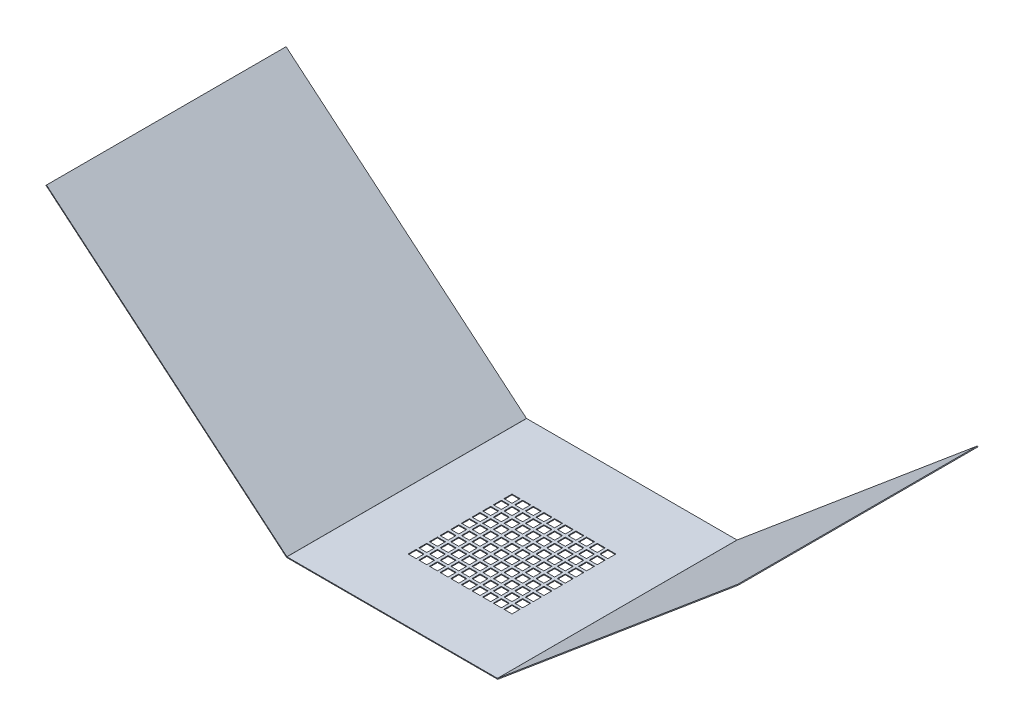
from build123d import *

# Parameters (mm, degrees)
CROQUIS1_W                = 800
CROQUIS1_H                = 900
BRIDA_BASE1_DEPTH         = 2.9
BRIDA_START               = -450
BRIDA_DE_ARISTA1_DEPTH    = 900
BRIDA_DE_ARISTA1_2_DEPTH  = 900
CROQUIS12_W               = 30
CROQUIS12_H               = 30
CORTAR_EXTRUIR1_DEPTH     = 10
MATRIZL1_COUNT            = 10
MATRIZL1_PITCH            = 40
MATRIZL2_COUNT            = 10
MATRIZL2_PITCH            = 40
MATRIZL2_COPY_1_SKETCH_W  = 30
MATRIZL2_COPY_1_SKETCH_H  = 30
MATRIZL2_COPY_1_DEPTH     = 10
MATRIZL2_COPY_2_SKETCH_W  = 30
MATRIZL2_COPY_2_SKETCH_H  = 30
MATRIZL2_COPY_2_DEPTH     = 10
MATRIZL2_COPY_3_SKETCH_W  = 30
MATRIZL2_COPY_3_SKETCH_H  = 30
MATRIZL2_COPY_3_DEPTH     = 10
MATRIZL2_COPY_4_SKETCH_W  = 30
MATRIZL2_COPY_4_SKETCH_H  = 30
MATRIZL2_COPY_4_DEPTH     = 10
MATRIZL2_COPY_5_SKETCH_W  = 30
MATRIZL2_COPY_5_SKETCH_H  = 30
MATRIZL2_COPY_5_DEPTH     = 10
MATRIZL2_COPY_6_SKETCH_W  = 30
MATRIZL2_COPY_6_SKETCH_H  = 30
MATRIZL2_COPY_6_DEPTH     = 10
MATRIZL2_COPY_7_SKETCH_W  = 30
MATRIZL2_COPY_7_SKETCH_H  = 30
MATRIZL2_COPY_7_DEPTH     = 10
MATRIZL2_COPY_8_SKETCH_W  = 30
MATRIZL2_COPY_8_SKETCH_H  = 30
MATRIZL2_COPY_8_DEPTH     = 10
MATRIZL2_COPY_9_SKETCH_W  = 30
MATRIZL2_COPY_9_SKETCH_H  = 30
MATRIZL2_COPY_9_DEPTH     = 10
MATRIZL2_COPY_10_SKETCH_W = 30
MATRIZL2_COPY_10_SKETCH_H = 30
MATRIZL2_COPY_10_DEPTH    = 10
MATRIZL2_COPY_11_SKETCH_W = 30
MATRIZL2_COPY_11_SKETCH_H = 30
MATRIZL2_COPY_11_DEPTH    = 10
MATRIZL2_COPY_12_SKETCH_W = 30
MATRIZL2_COPY_12_SKETCH_H = 30
MATRIZL2_COPY_12_DEPTH    = 10
MATRIZL2_COPY_13_SKETCH_W = 30
MATRIZL2_COPY_13_SKETCH_H = 30
MATRIZL2_COPY_13_DEPTH    = 10
MATRIZL2_COPY_14_SKETCH_W = 30
MATRIZL2_COPY_14_SKETCH_H = 30
MATRIZL2_COPY_14_DEPTH    = 10
MATRIZL2_COPY_15_SKETCH_W = 30
MATRIZL2_COPY_15_SKETCH_H = 30
MATRIZL2_COPY_15_DEPTH    = 10
MATRIZL2_COPY_16_SKETCH_W = 30
MATRIZL2_COPY_16_SKETCH_H = 30
MATRIZL2_COPY_16_DEPTH    = 10
MATRIZL2_COPY_17_SKETCH_W = 30
MATRIZL2_COPY_17_SKETCH_H = 30
MATRIZL2_COPY_17_DEPTH    = 10
MATRIZL2_COPY_18_SKETCH_W = 30
MATRIZL2_COPY_18_SKETCH_H = 30
MATRIZL2_COPY_18_DEPTH    = 10
MATRIZL2_COPY_19_SKETCH_W = 30
MATRIZL2_COPY_19_SKETCH_H = 30
MATRIZL2_COPY_19_DEPTH    = 10
MATRIZL2_COPY_20_SKETCH_W = 30
MATRIZL2_COPY_20_SKETCH_H = 30
MATRIZL2_COPY_20_DEPTH    = 10
MATRIZL2_COPY_21_SKETCH_W = 30
MATRIZL2_COPY_21_SKETCH_H = 30
MATRIZL2_COPY_21_DEPTH    = 10
MATRIZL2_COPY_22_SKETCH_W = 30
MATRIZL2_COPY_22_SKETCH_H = 30
MATRIZL2_COPY_22_DEPTH    = 10
MATRIZL2_COPY_23_SKETCH_W = 30
MATRIZL2_COPY_23_SKETCH_H = 30
MATRIZL2_COPY_23_DEPTH    = 10
MATRIZL2_COPY_24_SKETCH_W = 30
MATRIZL2_COPY_24_SKETCH_H = 30
MATRIZL2_COPY_24_DEPTH    = 10
MATRIZL2_COPY_25_SKETCH_W = 30
MATRIZL2_COPY_25_SKETCH_H = 30
MATRIZL2_COPY_25_DEPTH    = 10
MATRIZL2_COPY_26_SKETCH_W = 30
MATRIZL2_COPY_26_SKETCH_H = 30
MATRIZL2_COPY_26_DEPTH    = 10
MATRIZL2_COPY_27_SKETCH_W = 30
MATRIZL2_COPY_27_SKETCH_H = 30
MATRIZL2_COPY_27_DEPTH    = 10
MATRIZL2_COPY_28_SKETCH_W = 30
MATRIZL2_COPY_28_SKETCH_H = 30
MATRIZL2_COPY_28_DEPTH    = 10
MATRIZL2_COPY_29_SKETCH_W = 30
MATRIZL2_COPY_29_SKETCH_H = 30
MATRIZL2_COPY_29_DEPTH    = 10
MATRIZL2_COPY_30_SKETCH_W = 30
MATRIZL2_COPY_30_SKETCH_H = 30
MATRIZL2_COPY_30_DEPTH    = 10
MATRIZL2_COPY_31_SKETCH_W = 30
MATRIZL2_COPY_31_SKETCH_H = 30
MATRIZL2_COPY_31_DEPTH    = 10
MATRIZL2_COPY_32_SKETCH_W = 30
MATRIZL2_COPY_32_SKETCH_H = 30
MATRIZL2_COPY_32_DEPTH    = 10
MATRIZL2_COPY_33_SKETCH_W = 30
MATRIZL2_COPY_33_SKETCH_H = 30
MATRIZL2_COPY_33_DEPTH    = 10
MATRIZL2_COPY_34_SKETCH_W = 30
MATRIZL2_COPY_34_SKETCH_H = 30
MATRIZL2_COPY_34_DEPTH    = 10
MATRIZL2_COPY_35_SKETCH_W = 30
MATRIZL2_COPY_35_SKETCH_H = 30
MATRIZL2_COPY_35_DEPTH    = 10
MATRIZL2_COPY_36_SKETCH_W = 30
MATRIZL2_COPY_36_SKETCH_H = 30
MATRIZL2_COPY_36_DEPTH    = 10
MATRIZL2_COPY_37_SKETCH_W = 30
MATRIZL2_COPY_37_SKETCH_H = 30
MATRIZL2_COPY_37_DEPTH    = 10
MATRIZL2_COPY_38_SKETCH_W = 30
MATRIZL2_COPY_38_SKETCH_H = 30
MATRIZL2_COPY_38_DEPTH    = 10
MATRIZL2_COPY_39_SKETCH_W = 30
MATRIZL2_COPY_39_SKETCH_H = 30
MATRIZL2_COPY_39_DEPTH    = 10
MATRIZL2_COPY_40_SKETCH_W = 30
MATRIZL2_COPY_40_SKETCH_H = 30
MATRIZL2_COPY_40_DEPTH    = 10
MATRIZL2_COPY_41_SKETCH_W = 30
MATRIZL2_COPY_41_SKETCH_H = 30
MATRIZL2_COPY_41_DEPTH    = 10
MATRIZL2_COPY_42_SKETCH_W = 30
MATRIZL2_COPY_42_SKETCH_H = 30
MATRIZL2_COPY_42_DEPTH    = 10
MATRIZL2_COPY_43_SKETCH_W = 30
MATRIZL2_COPY_43_SKETCH_H = 30
MATRIZL2_COPY_43_DEPTH    = 10
MATRIZL2_COPY_44_SKETCH_W = 30
MATRIZL2_COPY_44_SKETCH_H = 30
MATRIZL2_COPY_44_DEPTH    = 10
MATRIZL2_COPY_45_SKETCH_W = 30
MATRIZL2_COPY_45_SKETCH_H = 30
MATRIZL2_COPY_45_DEPTH    = 10
MATRIZL2_COPY_46_SKETCH_W = 30
MATRIZL2_COPY_46_SKETCH_H = 30
MATRIZL2_COPY_46_DEPTH    = 10
MATRIZL2_COPY_47_SKETCH_W = 30
MATRIZL2_COPY_47_SKETCH_H = 30
MATRIZL2_COPY_47_DEPTH    = 10
MATRIZL2_COPY_48_SKETCH_W = 30
MATRIZL2_COPY_48_SKETCH_H = 30
MATRIZL2_COPY_48_DEPTH    = 10
MATRIZL2_COPY_49_SKETCH_W = 30
MATRIZL2_COPY_49_SKETCH_H = 30
MATRIZL2_COPY_49_DEPTH    = 10
MATRIZL2_COPY_50_SKETCH_W = 30
MATRIZL2_COPY_50_SKETCH_H = 30
MATRIZL2_COPY_50_DEPTH    = 10
MATRIZL2_COPY_51_SKETCH_W = 30
MATRIZL2_COPY_51_SKETCH_H = 30
MATRIZL2_COPY_51_DEPTH    = 10
MATRIZL2_COPY_52_SKETCH_W = 30
MATRIZL2_COPY_52_SKETCH_H = 30
MATRIZL2_COPY_52_DEPTH    = 10
MATRIZL2_COPY_53_SKETCH_W = 30
MATRIZL2_COPY_53_SKETCH_H = 30
MATRIZL2_COPY_53_DEPTH    = 10
MATRIZL2_COPY_54_SKETCH_W = 30
MATRIZL2_COPY_54_SKETCH_H = 30
MATRIZL2_COPY_54_DEPTH    = 10
MATRIZL2_COPY_55_SKETCH_W = 30
MATRIZL2_COPY_55_SKETCH_H = 30
MATRIZL2_COPY_55_DEPTH    = 10
MATRIZL2_COPY_56_SKETCH_W = 30
MATRIZL2_COPY_56_SKETCH_H = 30
MATRIZL2_COPY_56_DEPTH    = 10
MATRIZL2_COPY_57_SKETCH_W = 30
MATRIZL2_COPY_57_SKETCH_H = 30
MATRIZL2_COPY_57_DEPTH    = 10
MATRIZL2_COPY_58_SKETCH_W = 30
MATRIZL2_COPY_58_SKETCH_H = 30
MATRIZL2_COPY_58_DEPTH    = 10
MATRIZL2_COPY_59_SKETCH_W = 30
MATRIZL2_COPY_59_SKETCH_H = 30
MATRIZL2_COPY_59_DEPTH    = 10
MATRIZL2_COPY_60_SKETCH_W = 30
MATRIZL2_COPY_60_SKETCH_H = 30
MATRIZL2_COPY_60_DEPTH    = 10
MATRIZL2_COPY_61_SKETCH_W = 30
MATRIZL2_COPY_61_SKETCH_H = 30
MATRIZL2_COPY_61_DEPTH    = 10
MATRIZL2_COPY_62_SKETCH_W = 30
MATRIZL2_COPY_62_SKETCH_H = 30
MATRIZL2_COPY_62_DEPTH    = 10
MATRIZL2_COPY_63_SKETCH_W = 30
MATRIZL2_COPY_63_SKETCH_H = 30
MATRIZL2_COPY_63_DEPTH    = 10
MATRIZL2_COPY_64_SKETCH_W = 30
MATRIZL2_COPY_64_SKETCH_H = 30
MATRIZL2_COPY_64_DEPTH    = 10
MATRIZL2_COPY_65_SKETCH_W = 30
MATRIZL2_COPY_65_SKETCH_H = 30
MATRIZL2_COPY_65_DEPTH    = 10
MATRIZL2_COPY_66_SKETCH_W = 30
MATRIZL2_COPY_66_SKETCH_H = 30
MATRIZL2_COPY_66_DEPTH    = 10
MATRIZL2_COPY_67_SKETCH_W = 30
MATRIZL2_COPY_67_SKETCH_H = 30
MATRIZL2_COPY_67_DEPTH    = 10
MATRIZL2_COPY_68_SKETCH_W = 30
MATRIZL2_COPY_68_SKETCH_H = 30
MATRIZL2_COPY_68_DEPTH    = 10
MATRIZL2_COPY_69_SKETCH_W = 30
MATRIZL2_COPY_69_SKETCH_H = 30
MATRIZL2_COPY_69_DEPTH    = 10
MATRIZL2_COPY_70_SKETCH_W = 30
MATRIZL2_COPY_70_SKETCH_H = 30
MATRIZL2_COPY_70_DEPTH    = 10
MATRIZL2_COPY_71_SKETCH_W = 30
MATRIZL2_COPY_71_SKETCH_H = 30
MATRIZL2_COPY_71_DEPTH    = 10
MATRIZL2_COPY_72_SKETCH_W = 30
MATRIZL2_COPY_72_SKETCH_H = 30
MATRIZL2_COPY_72_DEPTH    = 10
MATRIZL2_COPY_73_SKETCH_W = 30
MATRIZL2_COPY_73_SKETCH_H = 30
MATRIZL2_COPY_73_DEPTH    = 10
MATRIZL2_COPY_74_SKETCH_W = 30
MATRIZL2_COPY_74_SKETCH_H = 30
MATRIZL2_COPY_74_DEPTH    = 10
MATRIZL2_COPY_75_SKETCH_W = 30
MATRIZL2_COPY_75_SKETCH_H = 30
MATRIZL2_COPY_75_DEPTH    = 10
MATRIZL2_COPY_76_SKETCH_W = 30
MATRIZL2_COPY_76_SKETCH_H = 30
MATRIZL2_COPY_76_DEPTH    = 10
MATRIZL2_COPY_77_SKETCH_W = 30
MATRIZL2_COPY_77_SKETCH_H = 30
MATRIZL2_COPY_77_DEPTH    = 10
MATRIZL2_COPY_78_SKETCH_W = 30
MATRIZL2_COPY_78_SKETCH_H = 30
MATRIZL2_COPY_78_DEPTH    = 10
MATRIZL2_COPY_79_SKETCH_W = 30
MATRIZL2_COPY_79_SKETCH_H = 30
MATRIZL2_COPY_79_DEPTH    = 10
MATRIZL2_COPY_80_SKETCH_W = 30
MATRIZL2_COPY_80_SKETCH_H = 30
MATRIZL2_COPY_80_DEPTH    = 10
MATRIZL2_COPY_81_SKETCH_W = 30
MATRIZL2_COPY_81_SKETCH_H = 30
MATRIZL2_COPY_81_DEPTH    = 10


# Read off the part's stored shape, not the designer's step: Brida de arista1
# Sheet-metal steps are written as plain solids
with BuildPart() as part:
    # Croquis1 → Brida base1 (new body)
    with BuildSketch(Plane(origin=(0, 0, 0), x_dir=(1, 0, 0), z_dir=(0, 1, 0))):
        Rectangle(CROQUIS1_W, CROQUIS1_H)
    extrude(amount=-BRIDA_BASE1_DEPTH)

    # Brida de arista1 outline → Brida de arista1 (cut)
    with BuildSketch(Plane.XY.offset(BRIDA_START)):
        with BuildLine():
            ThreePointArc((-395.220300428, -2.9), (-396.464090881, -2.680686185), (-397.557861849, -2.049197222))
            Line((-397.557861849, -2.049197222), (-400, 0))
            Line((-400, 0), (-400, -2.9))
            Line((-400, -2.9), (-395.220300428, -2.9))
        make_face()
        with BuildLine():
            ThreePointArc((397.557861849, -2.049197222), (396.464090881, -2.680686185), (395.220300428, -2.9))
            Line((395.220300428, -2.9), (400, -2.9))
            Line((400, -2.9), (400, 0))
            Line((400, 0), (397.557861849, -2.049197222))
        make_face()
    extrude(amount=BRIDA_DE_ARISTA1_DEPTH, mode=Mode.SUBTRACT)

    # Brida de arista1 2 outline → Brida de arista1 2 (add)
    with BuildSketch(Plane.XY.offset(BRIDA_START)):
        with BuildLine():
            Line((-1300.476357462, 755.58937943), (-400, 0))
            Line((-400, 0), (-395.220300428, 0))
            ThreePointArc((-395.220300428, 0), (-395.472232465, 0.044422416), (-395.693777781, 0.172331663))
            Line((-395.693777781, 0.172331663), (-1298.612273394, 757.810908315))
            Line((-1298.612273394, 757.810908315), (-1300.476357462, 755.58937943))
        make_face()
        with BuildLine():
            ThreePointArc((395.693777781, 0.172331663), (395.472232465, 0.044422416), (395.220300428, 0))
            Line((395.220300428, 0), (400, 0))
            Line((400, 0), (1300.476357462, 755.58937943))
            Line((1300.476357462, 755.58937943), (1298.612273394, 757.810908315))
            Line((1298.612273394, 757.810908315), (395.693777781, 0.172331663))
        make_face()
    extrude(amount=BRIDA_DE_ARISTA1_2_DEPTH)

    # Croquis12 → Cortar-Extruir1 (cut)
    with BuildSketch(Plane(origin=(0, 0, 0), x_dir=(1, 0, 0), z_dir=(0, 1, 0))):
        with Locations((-161.776695297, 161.776695297)):
            Rectangle(CROQUIS12_W, CROQUIS12_H)
    cortar_extruir1 = extrude(amount=-CORTAR_EXTRUIR1_DEPTH, mode=Mode.SUBTRACT)

    # MatrizL1: Cortar-Extruir1 ×10
    with Locations(*[(i * MATRIZL1_PITCH, 0, 0) for i in range(1, MATRIZL1_COUNT)]):
        add(cortar_extruir1, mode=Mode.SUBTRACT)

    # MatrizL2: Cortar-Extruir1 ×10
    with Locations(*[(0, 0, i * MATRIZL2_PITCH) for i in range(1, MATRIZL2_COUNT)]):
        add(cortar_extruir1, mode=Mode.SUBTRACT)

    # MatrizL2 copy 1 sketch → MatrizL2 copy 1 (cut)
    with BuildSketch(Plane(origin=(40, 0, 40), x_dir=(1, 0, 0), z_dir=(0, 1, 0))):
        with Locations((-161.776695297, 161.776695297)):
            Rectangle(MATRIZL2_COPY_1_SKETCH_W, MATRIZL2_COPY_1_SKETCH_H)
    extrude(amount=-MATRIZL2_COPY_1_DEPTH, mode=Mode.SUBTRACT)

    # MatrizL2 copy 2 sketch → MatrizL2 copy 2 (cut)
    with BuildSketch(Plane(origin=(40, 0, 80), x_dir=(1, 0, 0), z_dir=(0, 1, 0))):
        with Locations((-161.776695297, 161.776695297)):
            Rectangle(MATRIZL2_COPY_2_SKETCH_W, MATRIZL2_COPY_2_SKETCH_H)
    extrude(amount=-MATRIZL2_COPY_2_DEPTH, mode=Mode.SUBTRACT)

    # MatrizL2 copy 3 sketch → MatrizL2 copy 3 (cut)
    with BuildSketch(Plane(origin=(40, 0, 120), x_dir=(1, 0, 0), z_dir=(0, 1, 0))):
        with Locations((-161.776695297, 161.776695297)):
            Rectangle(MATRIZL2_COPY_3_SKETCH_W, MATRIZL2_COPY_3_SKETCH_H)
    extrude(amount=-MATRIZL2_COPY_3_DEPTH, mode=Mode.SUBTRACT)

    # MatrizL2 copy 4 sketch → MatrizL2 copy 4 (cut)
    with BuildSketch(Plane(origin=(40, 0, 160), x_dir=(1, 0, 0), z_dir=(0, 1, 0))):
        with Locations((-161.776695297, 161.776695297)):
            Rectangle(MATRIZL2_COPY_4_SKETCH_W, MATRIZL2_COPY_4_SKETCH_H)
    extrude(amount=-MATRIZL2_COPY_4_DEPTH, mode=Mode.SUBTRACT)

    # MatrizL2 copy 5 sketch → MatrizL2 copy 5 (cut)
    with BuildSketch(Plane(origin=(40, 0, 200), x_dir=(1, 0, 0), z_dir=(0, 1, 0))):
        with Locations((-161.776695297, 161.776695297)):
            Rectangle(MATRIZL2_COPY_5_SKETCH_W, MATRIZL2_COPY_5_SKETCH_H)
    extrude(amount=-MATRIZL2_COPY_5_DEPTH, mode=Mode.SUBTRACT)

    # MatrizL2 copy 6 sketch → MatrizL2 copy 6 (cut)
    with BuildSketch(Plane(origin=(40, 0, 240), x_dir=(1, 0, 0), z_dir=(0, 1, 0))):
        with Locations((-161.776695297, 161.776695297)):
            Rectangle(MATRIZL2_COPY_6_SKETCH_W, MATRIZL2_COPY_6_SKETCH_H)
    extrude(amount=-MATRIZL2_COPY_6_DEPTH, mode=Mode.SUBTRACT)

    # MatrizL2 copy 7 sketch → MatrizL2 copy 7 (cut)
    with BuildSketch(Plane(origin=(40, 0, 280), x_dir=(1, 0, 0), z_dir=(0, 1, 0))):
        with Locations((-161.776695297, 161.776695297)):
            Rectangle(MATRIZL2_COPY_7_SKETCH_W, MATRIZL2_COPY_7_SKETCH_H)
    extrude(amount=-MATRIZL2_COPY_7_DEPTH, mode=Mode.SUBTRACT)

    # MatrizL2 copy 8 sketch → MatrizL2 copy 8 (cut)
    with BuildSketch(Plane(origin=(40, 0, 320), x_dir=(1, 0, 0), z_dir=(0, 1, 0))):
        with Locations((-161.776695297, 161.776695297)):
            Rectangle(MATRIZL2_COPY_8_SKETCH_W, MATRIZL2_COPY_8_SKETCH_H)
    extrude(amount=-MATRIZL2_COPY_8_DEPTH, mode=Mode.SUBTRACT)

    # MatrizL2 copy 9 sketch → MatrizL2 copy 9 (cut)
    with BuildSketch(Plane(origin=(40, 0, 360), x_dir=(1, 0, 0), z_dir=(0, 1, 0))):
        with Locations((-161.776695297, 161.776695297)):
            Rectangle(MATRIZL2_COPY_9_SKETCH_W, MATRIZL2_COPY_9_SKETCH_H)
    extrude(amount=-MATRIZL2_COPY_9_DEPTH, mode=Mode.SUBTRACT)

    # MatrizL2 copy 10 sketch → MatrizL2 copy 10 (cut)
    with BuildSketch(Plane(origin=(80, 0, 40), x_dir=(1, 0, 0), z_dir=(0, 1, 0))):
        with Locations((-161.776695297, 161.776695297)):
            Rectangle(MATRIZL2_COPY_10_SKETCH_W, MATRIZL2_COPY_10_SKETCH_H)
    extrude(amount=-MATRIZL2_COPY_10_DEPTH, mode=Mode.SUBTRACT)

    # MatrizL2 copy 11 sketch → MatrizL2 copy 11 (cut)
    with BuildSketch(Plane(origin=(80, 0, 80), x_dir=(1, 0, 0), z_dir=(0, 1, 0))):
        with Locations((-161.776695297, 161.776695297)):
            Rectangle(MATRIZL2_COPY_11_SKETCH_W, MATRIZL2_COPY_11_SKETCH_H)
    extrude(amount=-MATRIZL2_COPY_11_DEPTH, mode=Mode.SUBTRACT)

    # MatrizL2 copy 12 sketch → MatrizL2 copy 12 (cut)
    with BuildSketch(Plane(origin=(80, 0, 120), x_dir=(1, 0, 0), z_dir=(0, 1, 0))):
        with Locations((-161.776695297, 161.776695297)):
            Rectangle(MATRIZL2_COPY_12_SKETCH_W, MATRIZL2_COPY_12_SKETCH_H)
    extrude(amount=-MATRIZL2_COPY_12_DEPTH, mode=Mode.SUBTRACT)

    # MatrizL2 copy 13 sketch → MatrizL2 copy 13 (cut)
    with BuildSketch(Plane(origin=(80, 0, 160), x_dir=(1, 0, 0), z_dir=(0, 1, 0))):
        with Locations((-161.776695297, 161.776695297)):
            Rectangle(MATRIZL2_COPY_13_SKETCH_W, MATRIZL2_COPY_13_SKETCH_H)
    extrude(amount=-MATRIZL2_COPY_13_DEPTH, mode=Mode.SUBTRACT)

    # MatrizL2 copy 14 sketch → MatrizL2 copy 14 (cut)
    with BuildSketch(Plane(origin=(80, 0, 200), x_dir=(1, 0, 0), z_dir=(0, 1, 0))):
        with Locations((-161.776695297, 161.776695297)):
            Rectangle(MATRIZL2_COPY_14_SKETCH_W, MATRIZL2_COPY_14_SKETCH_H)
    extrude(amount=-MATRIZL2_COPY_14_DEPTH, mode=Mode.SUBTRACT)

    # MatrizL2 copy 15 sketch → MatrizL2 copy 15 (cut)
    with BuildSketch(Plane(origin=(80, 0, 240), x_dir=(1, 0, 0), z_dir=(0, 1, 0))):
        with Locations((-161.776695297, 161.776695297)):
            Rectangle(MATRIZL2_COPY_15_SKETCH_W, MATRIZL2_COPY_15_SKETCH_H)
    extrude(amount=-MATRIZL2_COPY_15_DEPTH, mode=Mode.SUBTRACT)

    # MatrizL2 copy 16 sketch → MatrizL2 copy 16 (cut)
    with BuildSketch(Plane(origin=(80, 0, 280), x_dir=(1, 0, 0), z_dir=(0, 1, 0))):
        with Locations((-161.776695297, 161.776695297)):
            Rectangle(MATRIZL2_COPY_16_SKETCH_W, MATRIZL2_COPY_16_SKETCH_H)
    extrude(amount=-MATRIZL2_COPY_16_DEPTH, mode=Mode.SUBTRACT)

    # MatrizL2 copy 17 sketch → MatrizL2 copy 17 (cut)
    with BuildSketch(Plane(origin=(80, 0, 320), x_dir=(1, 0, 0), z_dir=(0, 1, 0))):
        with Locations((-161.776695297, 161.776695297)):
            Rectangle(MATRIZL2_COPY_17_SKETCH_W, MATRIZL2_COPY_17_SKETCH_H)
    extrude(amount=-MATRIZL2_COPY_17_DEPTH, mode=Mode.SUBTRACT)

    # MatrizL2 copy 18 sketch → MatrizL2 copy 18 (cut)
    with BuildSketch(Plane(origin=(80, 0, 360), x_dir=(1, 0, 0), z_dir=(0, 1, 0))):
        with Locations((-161.776695297, 161.776695297)):
            Rectangle(MATRIZL2_COPY_18_SKETCH_W, MATRIZL2_COPY_18_SKETCH_H)
    extrude(amount=-MATRIZL2_COPY_18_DEPTH, mode=Mode.SUBTRACT)

    # MatrizL2 copy 19 sketch → MatrizL2 copy 19 (cut)
    with BuildSketch(Plane(origin=(120, 0, 40), x_dir=(1, 0, 0), z_dir=(0, 1, 0))):
        with Locations((-161.776695297, 161.776695297)):
            Rectangle(MATRIZL2_COPY_19_SKETCH_W, MATRIZL2_COPY_19_SKETCH_H)
    extrude(amount=-MATRIZL2_COPY_19_DEPTH, mode=Mode.SUBTRACT)

    # MatrizL2 copy 20 sketch → MatrizL2 copy 20 (cut)
    with BuildSketch(Plane(origin=(120, 0, 80), x_dir=(1, 0, 0), z_dir=(0, 1, 0))):
        with Locations((-161.776695297, 161.776695297)):
            Rectangle(MATRIZL2_COPY_20_SKETCH_W, MATRIZL2_COPY_20_SKETCH_H)
    extrude(amount=-MATRIZL2_COPY_20_DEPTH, mode=Mode.SUBTRACT)

    # MatrizL2 copy 21 sketch → MatrizL2 copy 21 (cut)
    with BuildSketch(Plane(origin=(120, 0, 120), x_dir=(1, 0, 0), z_dir=(0, 1, 0))):
        with Locations((-161.776695297, 161.776695297)):
            Rectangle(MATRIZL2_COPY_21_SKETCH_W, MATRIZL2_COPY_21_SKETCH_H)
    extrude(amount=-MATRIZL2_COPY_21_DEPTH, mode=Mode.SUBTRACT)

    # MatrizL2 copy 22 sketch → MatrizL2 copy 22 (cut)
    with BuildSketch(Plane(origin=(120, 0, 160), x_dir=(1, 0, 0), z_dir=(0, 1, 0))):
        with Locations((-161.776695297, 161.776695297)):
            Rectangle(MATRIZL2_COPY_22_SKETCH_W, MATRIZL2_COPY_22_SKETCH_H)
    extrude(amount=-MATRIZL2_COPY_22_DEPTH, mode=Mode.SUBTRACT)

    # MatrizL2 copy 23 sketch → MatrizL2 copy 23 (cut)
    with BuildSketch(Plane(origin=(120, 0, 200), x_dir=(1, 0, 0), z_dir=(0, 1, 0))):
        with Locations((-161.776695297, 161.776695297)):
            Rectangle(MATRIZL2_COPY_23_SKETCH_W, MATRIZL2_COPY_23_SKETCH_H)
    extrude(amount=-MATRIZL2_COPY_23_DEPTH, mode=Mode.SUBTRACT)

    # MatrizL2 copy 24 sketch → MatrizL2 copy 24 (cut)
    with BuildSketch(Plane(origin=(120, 0, 240), x_dir=(1, 0, 0), z_dir=(0, 1, 0))):
        with Locations((-161.776695297, 161.776695297)):
            Rectangle(MATRIZL2_COPY_24_SKETCH_W, MATRIZL2_COPY_24_SKETCH_H)
    extrude(amount=-MATRIZL2_COPY_24_DEPTH, mode=Mode.SUBTRACT)

    # MatrizL2 copy 25 sketch → MatrizL2 copy 25 (cut)
    with BuildSketch(Plane(origin=(120, 0, 280), x_dir=(1, 0, 0), z_dir=(0, 1, 0))):
        with Locations((-161.776695297, 161.776695297)):
            Rectangle(MATRIZL2_COPY_25_SKETCH_W, MATRIZL2_COPY_25_SKETCH_H)
    extrude(amount=-MATRIZL2_COPY_25_DEPTH, mode=Mode.SUBTRACT)

    # MatrizL2 copy 26 sketch → MatrizL2 copy 26 (cut)
    with BuildSketch(Plane(origin=(120, 0, 320), x_dir=(1, 0, 0), z_dir=(0, 1, 0))):
        with Locations((-161.776695297, 161.776695297)):
            Rectangle(MATRIZL2_COPY_26_SKETCH_W, MATRIZL2_COPY_26_SKETCH_H)
    extrude(amount=-MATRIZL2_COPY_26_DEPTH, mode=Mode.SUBTRACT)

    # MatrizL2 copy 27 sketch → MatrizL2 copy 27 (cut)
    with BuildSketch(Plane(origin=(120, 0, 360), x_dir=(1, 0, 0), z_dir=(0, 1, 0))):
        with Locations((-161.776695297, 161.776695297)):
            Rectangle(MATRIZL2_COPY_27_SKETCH_W, MATRIZL2_COPY_27_SKETCH_H)
    extrude(amount=-MATRIZL2_COPY_27_DEPTH, mode=Mode.SUBTRACT)

    # MatrizL2 copy 28 sketch → MatrizL2 copy 28 (cut)
    with BuildSketch(Plane(origin=(160, 0, 40), x_dir=(1, 0, 0), z_dir=(0, 1, 0))):
        with Locations((-161.776695297, 161.776695297)):
            Rectangle(MATRIZL2_COPY_28_SKETCH_W, MATRIZL2_COPY_28_SKETCH_H)
    extrude(amount=-MATRIZL2_COPY_28_DEPTH, mode=Mode.SUBTRACT)

    # MatrizL2 copy 29 sketch → MatrizL2 copy 29 (cut)
    with BuildSketch(Plane(origin=(160, 0, 80), x_dir=(1, 0, 0), z_dir=(0, 1, 0))):
        with Locations((-161.776695297, 161.776695297)):
            Rectangle(MATRIZL2_COPY_29_SKETCH_W, MATRIZL2_COPY_29_SKETCH_H)
    extrude(amount=-MATRIZL2_COPY_29_DEPTH, mode=Mode.SUBTRACT)

    # MatrizL2 copy 30 sketch → MatrizL2 copy 30 (cut)
    with BuildSketch(Plane(origin=(160, 0, 120), x_dir=(1, 0, 0), z_dir=(0, 1, 0))):
        with Locations((-161.776695297, 161.776695297)):
            Rectangle(MATRIZL2_COPY_30_SKETCH_W, MATRIZL2_COPY_30_SKETCH_H)
    extrude(amount=-MATRIZL2_COPY_30_DEPTH, mode=Mode.SUBTRACT)

    # MatrizL2 copy 31 sketch → MatrizL2 copy 31 (cut)
    with BuildSketch(Plane(origin=(160, 0, 160), x_dir=(1, 0, 0), z_dir=(0, 1, 0))):
        with Locations((-161.776695297, 161.776695297)):
            Rectangle(MATRIZL2_COPY_31_SKETCH_W, MATRIZL2_COPY_31_SKETCH_H)
    extrude(amount=-MATRIZL2_COPY_31_DEPTH, mode=Mode.SUBTRACT)

    # MatrizL2 copy 32 sketch → MatrizL2 copy 32 (cut)
    with BuildSketch(Plane(origin=(160, 0, 200), x_dir=(1, 0, 0), z_dir=(0, 1, 0))):
        with Locations((-161.776695297, 161.776695297)):
            Rectangle(MATRIZL2_COPY_32_SKETCH_W, MATRIZL2_COPY_32_SKETCH_H)
    extrude(amount=-MATRIZL2_COPY_32_DEPTH, mode=Mode.SUBTRACT)

    # MatrizL2 copy 33 sketch → MatrizL2 copy 33 (cut)
    with BuildSketch(Plane(origin=(160, 0, 240), x_dir=(1, 0, 0), z_dir=(0, 1, 0))):
        with Locations((-161.776695297, 161.776695297)):
            Rectangle(MATRIZL2_COPY_33_SKETCH_W, MATRIZL2_COPY_33_SKETCH_H)
    extrude(amount=-MATRIZL2_COPY_33_DEPTH, mode=Mode.SUBTRACT)

    # MatrizL2 copy 34 sketch → MatrizL2 copy 34 (cut)
    with BuildSketch(Plane(origin=(160, 0, 280), x_dir=(1, 0, 0), z_dir=(0, 1, 0))):
        with Locations((-161.776695297, 161.776695297)):
            Rectangle(MATRIZL2_COPY_34_SKETCH_W, MATRIZL2_COPY_34_SKETCH_H)
    extrude(amount=-MATRIZL2_COPY_34_DEPTH, mode=Mode.SUBTRACT)

    # MatrizL2 copy 35 sketch → MatrizL2 copy 35 (cut)
    with BuildSketch(Plane(origin=(160, 0, 320), x_dir=(1, 0, 0), z_dir=(0, 1, 0))):
        with Locations((-161.776695297, 161.776695297)):
            Rectangle(MATRIZL2_COPY_35_SKETCH_W, MATRIZL2_COPY_35_SKETCH_H)
    extrude(amount=-MATRIZL2_COPY_35_DEPTH, mode=Mode.SUBTRACT)

    # MatrizL2 copy 36 sketch → MatrizL2 copy 36 (cut)
    with BuildSketch(Plane(origin=(160, 0, 360), x_dir=(1, 0, 0), z_dir=(0, 1, 0))):
        with Locations((-161.776695297, 161.776695297)):
            Rectangle(MATRIZL2_COPY_36_SKETCH_W, MATRIZL2_COPY_36_SKETCH_H)
    extrude(amount=-MATRIZL2_COPY_36_DEPTH, mode=Mode.SUBTRACT)

    # MatrizL2 copy 37 sketch → MatrizL2 copy 37 (cut)
    with BuildSketch(Plane(origin=(200, 0, 40), x_dir=(1, 0, 0), z_dir=(0, 1, 0))):
        with Locations((-161.776695297, 161.776695297)):
            Rectangle(MATRIZL2_COPY_37_SKETCH_W, MATRIZL2_COPY_37_SKETCH_H)
    extrude(amount=-MATRIZL2_COPY_37_DEPTH, mode=Mode.SUBTRACT)

    # MatrizL2 copy 38 sketch → MatrizL2 copy 38 (cut)
    with BuildSketch(Plane(origin=(200, 0, 80), x_dir=(1, 0, 0), z_dir=(0, 1, 0))):
        with Locations((-161.776695297, 161.776695297)):
            Rectangle(MATRIZL2_COPY_38_SKETCH_W, MATRIZL2_COPY_38_SKETCH_H)
    extrude(amount=-MATRIZL2_COPY_38_DEPTH, mode=Mode.SUBTRACT)

    # MatrizL2 copy 39 sketch → MatrizL2 copy 39 (cut)
    with BuildSketch(Plane(origin=(200, 0, 120), x_dir=(1, 0, 0), z_dir=(0, 1, 0))):
        with Locations((-161.776695297, 161.776695297)):
            Rectangle(MATRIZL2_COPY_39_SKETCH_W, MATRIZL2_COPY_39_SKETCH_H)
    extrude(amount=-MATRIZL2_COPY_39_DEPTH, mode=Mode.SUBTRACT)

    # MatrizL2 copy 40 sketch → MatrizL2 copy 40 (cut)
    with BuildSketch(Plane(origin=(200, 0, 160), x_dir=(1, 0, 0), z_dir=(0, 1, 0))):
        with Locations((-161.776695297, 161.776695297)):
            Rectangle(MATRIZL2_COPY_40_SKETCH_W, MATRIZL2_COPY_40_SKETCH_H)
    extrude(amount=-MATRIZL2_COPY_40_DEPTH, mode=Mode.SUBTRACT)

    # MatrizL2 copy 41 sketch → MatrizL2 copy 41 (cut)
    with BuildSketch(Plane(origin=(200, 0, 200), x_dir=(1, 0, 0), z_dir=(0, 1, 0))):
        with Locations((-161.776695297, 161.776695297)):
            Rectangle(MATRIZL2_COPY_41_SKETCH_W, MATRIZL2_COPY_41_SKETCH_H)
    extrude(amount=-MATRIZL2_COPY_41_DEPTH, mode=Mode.SUBTRACT)

    # MatrizL2 copy 42 sketch → MatrizL2 copy 42 (cut)
    with BuildSketch(Plane(origin=(200, 0, 240), x_dir=(1, 0, 0), z_dir=(0, 1, 0))):
        with Locations((-161.776695297, 161.776695297)):
            Rectangle(MATRIZL2_COPY_42_SKETCH_W, MATRIZL2_COPY_42_SKETCH_H)
    extrude(amount=-MATRIZL2_COPY_42_DEPTH, mode=Mode.SUBTRACT)

    # MatrizL2 copy 43 sketch → MatrizL2 copy 43 (cut)
    with BuildSketch(Plane(origin=(200, 0, 280), x_dir=(1, 0, 0), z_dir=(0, 1, 0))):
        with Locations((-161.776695297, 161.776695297)):
            Rectangle(MATRIZL2_COPY_43_SKETCH_W, MATRIZL2_COPY_43_SKETCH_H)
    extrude(amount=-MATRIZL2_COPY_43_DEPTH, mode=Mode.SUBTRACT)

    # MatrizL2 copy 44 sketch → MatrizL2 copy 44 (cut)
    with BuildSketch(Plane(origin=(200, 0, 320), x_dir=(1, 0, 0), z_dir=(0, 1, 0))):
        with Locations((-161.776695297, 161.776695297)):
            Rectangle(MATRIZL2_COPY_44_SKETCH_W, MATRIZL2_COPY_44_SKETCH_H)
    extrude(amount=-MATRIZL2_COPY_44_DEPTH, mode=Mode.SUBTRACT)

    # MatrizL2 copy 45 sketch → MatrizL2 copy 45 (cut)
    with BuildSketch(Plane(origin=(200, 0, 360), x_dir=(1, 0, 0), z_dir=(0, 1, 0))):
        with Locations((-161.776695297, 161.776695297)):
            Rectangle(MATRIZL2_COPY_45_SKETCH_W, MATRIZL2_COPY_45_SKETCH_H)
    extrude(amount=-MATRIZL2_COPY_45_DEPTH, mode=Mode.SUBTRACT)

    # MatrizL2 copy 46 sketch → MatrizL2 copy 46 (cut)
    with BuildSketch(Plane(origin=(240, 0, 40), x_dir=(1, 0, 0), z_dir=(0, 1, 0))):
        with Locations((-161.776695297, 161.776695297)):
            Rectangle(MATRIZL2_COPY_46_SKETCH_W, MATRIZL2_COPY_46_SKETCH_H)
    extrude(amount=-MATRIZL2_COPY_46_DEPTH, mode=Mode.SUBTRACT)

    # MatrizL2 copy 47 sketch → MatrizL2 copy 47 (cut)
    with BuildSketch(Plane(origin=(240, 0, 80), x_dir=(1, 0, 0), z_dir=(0, 1, 0))):
        with Locations((-161.776695297, 161.776695297)):
            Rectangle(MATRIZL2_COPY_47_SKETCH_W, MATRIZL2_COPY_47_SKETCH_H)
    extrude(amount=-MATRIZL2_COPY_47_DEPTH, mode=Mode.SUBTRACT)

    # MatrizL2 copy 48 sketch → MatrizL2 copy 48 (cut)
    with BuildSketch(Plane(origin=(240, 0, 120), x_dir=(1, 0, 0), z_dir=(0, 1, 0))):
        with Locations((-161.776695297, 161.776695297)):
            Rectangle(MATRIZL2_COPY_48_SKETCH_W, MATRIZL2_COPY_48_SKETCH_H)
    extrude(amount=-MATRIZL2_COPY_48_DEPTH, mode=Mode.SUBTRACT)

    # MatrizL2 copy 49 sketch → MatrizL2 copy 49 (cut)
    with BuildSketch(Plane(origin=(240, 0, 160), x_dir=(1, 0, 0), z_dir=(0, 1, 0))):
        with Locations((-161.776695297, 161.776695297)):
            Rectangle(MATRIZL2_COPY_49_SKETCH_W, MATRIZL2_COPY_49_SKETCH_H)
    extrude(amount=-MATRIZL2_COPY_49_DEPTH, mode=Mode.SUBTRACT)

    # MatrizL2 copy 50 sketch → MatrizL2 copy 50 (cut)
    with BuildSketch(Plane(origin=(240, 0, 200), x_dir=(1, 0, 0), z_dir=(0, 1, 0))):
        with Locations((-161.776695297, 161.776695297)):
            Rectangle(MATRIZL2_COPY_50_SKETCH_W, MATRIZL2_COPY_50_SKETCH_H)
    extrude(amount=-MATRIZL2_COPY_50_DEPTH, mode=Mode.SUBTRACT)

    # MatrizL2 copy 51 sketch → MatrizL2 copy 51 (cut)
    with BuildSketch(Plane(origin=(240, 0, 240), x_dir=(1, 0, 0), z_dir=(0, 1, 0))):
        with Locations((-161.776695297, 161.776695297)):
            Rectangle(MATRIZL2_COPY_51_SKETCH_W, MATRIZL2_COPY_51_SKETCH_H)
    extrude(amount=-MATRIZL2_COPY_51_DEPTH, mode=Mode.SUBTRACT)

    # MatrizL2 copy 52 sketch → MatrizL2 copy 52 (cut)
    with BuildSketch(Plane(origin=(240, 0, 280), x_dir=(1, 0, 0), z_dir=(0, 1, 0))):
        with Locations((-161.776695297, 161.776695297)):
            Rectangle(MATRIZL2_COPY_52_SKETCH_W, MATRIZL2_COPY_52_SKETCH_H)
    extrude(amount=-MATRIZL2_COPY_52_DEPTH, mode=Mode.SUBTRACT)

    # MatrizL2 copy 53 sketch → MatrizL2 copy 53 (cut)
    with BuildSketch(Plane(origin=(240, 0, 320), x_dir=(1, 0, 0), z_dir=(0, 1, 0))):
        with Locations((-161.776695297, 161.776695297)):
            Rectangle(MATRIZL2_COPY_53_SKETCH_W, MATRIZL2_COPY_53_SKETCH_H)
    extrude(amount=-MATRIZL2_COPY_53_DEPTH, mode=Mode.SUBTRACT)

    # MatrizL2 copy 54 sketch → MatrizL2 copy 54 (cut)
    with BuildSketch(Plane(origin=(240, 0, 360), x_dir=(1, 0, 0), z_dir=(0, 1, 0))):
        with Locations((-161.776695297, 161.776695297)):
            Rectangle(MATRIZL2_COPY_54_SKETCH_W, MATRIZL2_COPY_54_SKETCH_H)
    extrude(amount=-MATRIZL2_COPY_54_DEPTH, mode=Mode.SUBTRACT)

    # MatrizL2 copy 55 sketch → MatrizL2 copy 55 (cut)
    with BuildSketch(Plane(origin=(280, 0, 40), x_dir=(1, 0, 0), z_dir=(0, 1, 0))):
        with Locations((-161.776695297, 161.776695297)):
            Rectangle(MATRIZL2_COPY_55_SKETCH_W, MATRIZL2_COPY_55_SKETCH_H)
    extrude(amount=-MATRIZL2_COPY_55_DEPTH, mode=Mode.SUBTRACT)

    # MatrizL2 copy 56 sketch → MatrizL2 copy 56 (cut)
    with BuildSketch(Plane(origin=(280, 0, 80), x_dir=(1, 0, 0), z_dir=(0, 1, 0))):
        with Locations((-161.776695297, 161.776695297)):
            Rectangle(MATRIZL2_COPY_56_SKETCH_W, MATRIZL2_COPY_56_SKETCH_H)
    extrude(amount=-MATRIZL2_COPY_56_DEPTH, mode=Mode.SUBTRACT)

    # MatrizL2 copy 57 sketch → MatrizL2 copy 57 (cut)
    with BuildSketch(Plane(origin=(280, 0, 120), x_dir=(1, 0, 0), z_dir=(0, 1, 0))):
        with Locations((-161.776695297, 161.776695297)):
            Rectangle(MATRIZL2_COPY_57_SKETCH_W, MATRIZL2_COPY_57_SKETCH_H)
    extrude(amount=-MATRIZL2_COPY_57_DEPTH, mode=Mode.SUBTRACT)

    # MatrizL2 copy 58 sketch → MatrizL2 copy 58 (cut)
    with BuildSketch(Plane(origin=(280, 0, 160), x_dir=(1, 0, 0), z_dir=(0, 1, 0))):
        with Locations((-161.776695297, 161.776695297)):
            Rectangle(MATRIZL2_COPY_58_SKETCH_W, MATRIZL2_COPY_58_SKETCH_H)
    extrude(amount=-MATRIZL2_COPY_58_DEPTH, mode=Mode.SUBTRACT)

    # MatrizL2 copy 59 sketch → MatrizL2 copy 59 (cut)
    with BuildSketch(Plane(origin=(280, 0, 200), x_dir=(1, 0, 0), z_dir=(0, 1, 0))):
        with Locations((-161.776695297, 161.776695297)):
            Rectangle(MATRIZL2_COPY_59_SKETCH_W, MATRIZL2_COPY_59_SKETCH_H)
    extrude(amount=-MATRIZL2_COPY_59_DEPTH, mode=Mode.SUBTRACT)

    # MatrizL2 copy 60 sketch → MatrizL2 copy 60 (cut)
    with BuildSketch(Plane(origin=(280, 0, 240), x_dir=(1, 0, 0), z_dir=(0, 1, 0))):
        with Locations((-161.776695297, 161.776695297)):
            Rectangle(MATRIZL2_COPY_60_SKETCH_W, MATRIZL2_COPY_60_SKETCH_H)
    extrude(amount=-MATRIZL2_COPY_60_DEPTH, mode=Mode.SUBTRACT)

    # MatrizL2 copy 61 sketch → MatrizL2 copy 61 (cut)
    with BuildSketch(Plane(origin=(280, 0, 280), x_dir=(1, 0, 0), z_dir=(0, 1, 0))):
        with Locations((-161.776695297, 161.776695297)):
            Rectangle(MATRIZL2_COPY_61_SKETCH_W, MATRIZL2_COPY_61_SKETCH_H)
    extrude(amount=-MATRIZL2_COPY_61_DEPTH, mode=Mode.SUBTRACT)

    # MatrizL2 copy 62 sketch → MatrizL2 copy 62 (cut)
    with BuildSketch(Plane(origin=(280, 0, 320), x_dir=(1, 0, 0), z_dir=(0, 1, 0))):
        with Locations((-161.776695297, 161.776695297)):
            Rectangle(MATRIZL2_COPY_62_SKETCH_W, MATRIZL2_COPY_62_SKETCH_H)
    extrude(amount=-MATRIZL2_COPY_62_DEPTH, mode=Mode.SUBTRACT)

    # MatrizL2 copy 63 sketch → MatrizL2 copy 63 (cut)
    with BuildSketch(Plane(origin=(280, 0, 360), x_dir=(1, 0, 0), z_dir=(0, 1, 0))):
        with Locations((-161.776695297, 161.776695297)):
            Rectangle(MATRIZL2_COPY_63_SKETCH_W, MATRIZL2_COPY_63_SKETCH_H)
    extrude(amount=-MATRIZL2_COPY_63_DEPTH, mode=Mode.SUBTRACT)

    # MatrizL2 copy 64 sketch → MatrizL2 copy 64 (cut)
    with BuildSketch(Plane(origin=(320, 0, 40), x_dir=(1, 0, 0), z_dir=(0, 1, 0))):
        with Locations((-161.776695297, 161.776695297)):
            Rectangle(MATRIZL2_COPY_64_SKETCH_W, MATRIZL2_COPY_64_SKETCH_H)
    extrude(amount=-MATRIZL2_COPY_64_DEPTH, mode=Mode.SUBTRACT)

    # MatrizL2 copy 65 sketch → MatrizL2 copy 65 (cut)
    with BuildSketch(Plane(origin=(320, 0, 80), x_dir=(1, 0, 0), z_dir=(0, 1, 0))):
        with Locations((-161.776695297, 161.776695297)):
            Rectangle(MATRIZL2_COPY_65_SKETCH_W, MATRIZL2_COPY_65_SKETCH_H)
    extrude(amount=-MATRIZL2_COPY_65_DEPTH, mode=Mode.SUBTRACT)

    # MatrizL2 copy 66 sketch → MatrizL2 copy 66 (cut)
    with BuildSketch(Plane(origin=(320, 0, 120), x_dir=(1, 0, 0), z_dir=(0, 1, 0))):
        with Locations((-161.776695297, 161.776695297)):
            Rectangle(MATRIZL2_COPY_66_SKETCH_W, MATRIZL2_COPY_66_SKETCH_H)
    extrude(amount=-MATRIZL2_COPY_66_DEPTH, mode=Mode.SUBTRACT)

    # MatrizL2 copy 67 sketch → MatrizL2 copy 67 (cut)
    with BuildSketch(Plane(origin=(320, 0, 160), x_dir=(1, 0, 0), z_dir=(0, 1, 0))):
        with Locations((-161.776695297, 161.776695297)):
            Rectangle(MATRIZL2_COPY_67_SKETCH_W, MATRIZL2_COPY_67_SKETCH_H)
    extrude(amount=-MATRIZL2_COPY_67_DEPTH, mode=Mode.SUBTRACT)

    # MatrizL2 copy 68 sketch → MatrizL2 copy 68 (cut)
    with BuildSketch(Plane(origin=(320, 0, 200), x_dir=(1, 0, 0), z_dir=(0, 1, 0))):
        with Locations((-161.776695297, 161.776695297)):
            Rectangle(MATRIZL2_COPY_68_SKETCH_W, MATRIZL2_COPY_68_SKETCH_H)
    extrude(amount=-MATRIZL2_COPY_68_DEPTH, mode=Mode.SUBTRACT)

    # MatrizL2 copy 69 sketch → MatrizL2 copy 69 (cut)
    with BuildSketch(Plane(origin=(320, 0, 240), x_dir=(1, 0, 0), z_dir=(0, 1, 0))):
        with Locations((-161.776695297, 161.776695297)):
            Rectangle(MATRIZL2_COPY_69_SKETCH_W, MATRIZL2_COPY_69_SKETCH_H)
    extrude(amount=-MATRIZL2_COPY_69_DEPTH, mode=Mode.SUBTRACT)

    # MatrizL2 copy 70 sketch → MatrizL2 copy 70 (cut)
    with BuildSketch(Plane(origin=(320, 0, 280), x_dir=(1, 0, 0), z_dir=(0, 1, 0))):
        with Locations((-161.776695297, 161.776695297)):
            Rectangle(MATRIZL2_COPY_70_SKETCH_W, MATRIZL2_COPY_70_SKETCH_H)
    extrude(amount=-MATRIZL2_COPY_70_DEPTH, mode=Mode.SUBTRACT)

    # MatrizL2 copy 71 sketch → MatrizL2 copy 71 (cut)
    with BuildSketch(Plane(origin=(320, 0, 320), x_dir=(1, 0, 0), z_dir=(0, 1, 0))):
        with Locations((-161.776695297, 161.776695297)):
            Rectangle(MATRIZL2_COPY_71_SKETCH_W, MATRIZL2_COPY_71_SKETCH_H)
    extrude(amount=-MATRIZL2_COPY_71_DEPTH, mode=Mode.SUBTRACT)

    # MatrizL2 copy 72 sketch → MatrizL2 copy 72 (cut)
    with BuildSketch(Plane(origin=(320, 0, 360), x_dir=(1, 0, 0), z_dir=(0, 1, 0))):
        with Locations((-161.776695297, 161.776695297)):
            Rectangle(MATRIZL2_COPY_72_SKETCH_W, MATRIZL2_COPY_72_SKETCH_H)
    extrude(amount=-MATRIZL2_COPY_72_DEPTH, mode=Mode.SUBTRACT)

    # MatrizL2 copy 73 sketch → MatrizL2 copy 73 (cut)
    with BuildSketch(Plane(origin=(360, 0, 40), x_dir=(1, 0, 0), z_dir=(0, 1, 0))):
        with Locations((-161.776695297, 161.776695297)):
            Rectangle(MATRIZL2_COPY_73_SKETCH_W, MATRIZL2_COPY_73_SKETCH_H)
    extrude(amount=-MATRIZL2_COPY_73_DEPTH, mode=Mode.SUBTRACT)

    # MatrizL2 copy 74 sketch → MatrizL2 copy 74 (cut)
    with BuildSketch(Plane(origin=(360, 0, 80), x_dir=(1, 0, 0), z_dir=(0, 1, 0))):
        with Locations((-161.776695297, 161.776695297)):
            Rectangle(MATRIZL2_COPY_74_SKETCH_W, MATRIZL2_COPY_74_SKETCH_H)
    extrude(amount=-MATRIZL2_COPY_74_DEPTH, mode=Mode.SUBTRACT)

    # MatrizL2 copy 75 sketch → MatrizL2 copy 75 (cut)
    with BuildSketch(Plane(origin=(360, 0, 120), x_dir=(1, 0, 0), z_dir=(0, 1, 0))):
        with Locations((-161.776695297, 161.776695297)):
            Rectangle(MATRIZL2_COPY_75_SKETCH_W, MATRIZL2_COPY_75_SKETCH_H)
    extrude(amount=-MATRIZL2_COPY_75_DEPTH, mode=Mode.SUBTRACT)

    # MatrizL2 copy 76 sketch → MatrizL2 copy 76 (cut)
    with BuildSketch(Plane(origin=(360, 0, 160), x_dir=(1, 0, 0), z_dir=(0, 1, 0))):
        with Locations((-161.776695297, 161.776695297)):
            Rectangle(MATRIZL2_COPY_76_SKETCH_W, MATRIZL2_COPY_76_SKETCH_H)
    extrude(amount=-MATRIZL2_COPY_76_DEPTH, mode=Mode.SUBTRACT)

    # MatrizL2 copy 77 sketch → MatrizL2 copy 77 (cut)
    with BuildSketch(Plane(origin=(360, 0, 200), x_dir=(1, 0, 0), z_dir=(0, 1, 0))):
        with Locations((-161.776695297, 161.776695297)):
            Rectangle(MATRIZL2_COPY_77_SKETCH_W, MATRIZL2_COPY_77_SKETCH_H)
    extrude(amount=-MATRIZL2_COPY_77_DEPTH, mode=Mode.SUBTRACT)

    # MatrizL2 copy 78 sketch → MatrizL2 copy 78 (cut)
    with BuildSketch(Plane(origin=(360, 0, 240), x_dir=(1, 0, 0), z_dir=(0, 1, 0))):
        with Locations((-161.776695297, 161.776695297)):
            Rectangle(MATRIZL2_COPY_78_SKETCH_W, MATRIZL2_COPY_78_SKETCH_H)
    extrude(amount=-MATRIZL2_COPY_78_DEPTH, mode=Mode.SUBTRACT)

    # MatrizL2 copy 79 sketch → MatrizL2 copy 79 (cut)
    with BuildSketch(Plane(origin=(360, 0, 280), x_dir=(1, 0, 0), z_dir=(0, 1, 0))):
        with Locations((-161.776695297, 161.776695297)):
            Rectangle(MATRIZL2_COPY_79_SKETCH_W, MATRIZL2_COPY_79_SKETCH_H)
    extrude(amount=-MATRIZL2_COPY_79_DEPTH, mode=Mode.SUBTRACT)

    # MatrizL2 copy 80 sketch → MatrizL2 copy 80 (cut)
    with BuildSketch(Plane(origin=(360, 0, 320), x_dir=(1, 0, 0), z_dir=(0, 1, 0))):
        with Locations((-161.776695297, 161.776695297)):
            Rectangle(MATRIZL2_COPY_80_SKETCH_W, MATRIZL2_COPY_80_SKETCH_H)
    extrude(amount=-MATRIZL2_COPY_80_DEPTH, mode=Mode.SUBTRACT)

    # MatrizL2 copy 81 sketch → MatrizL2 copy 81 (cut)
    with BuildSketch(Plane(origin=(360, 0, 360), x_dir=(1, 0, 0), z_dir=(0, 1, 0))):
        with Locations((-161.776695297, 161.776695297)):
            Rectangle(MATRIZL2_COPY_81_SKETCH_W, MATRIZL2_COPY_81_SKETCH_H)
    extrude(amount=-MATRIZL2_COPY_81_DEPTH, mode=Mode.SUBTRACT)


solid = part.part
